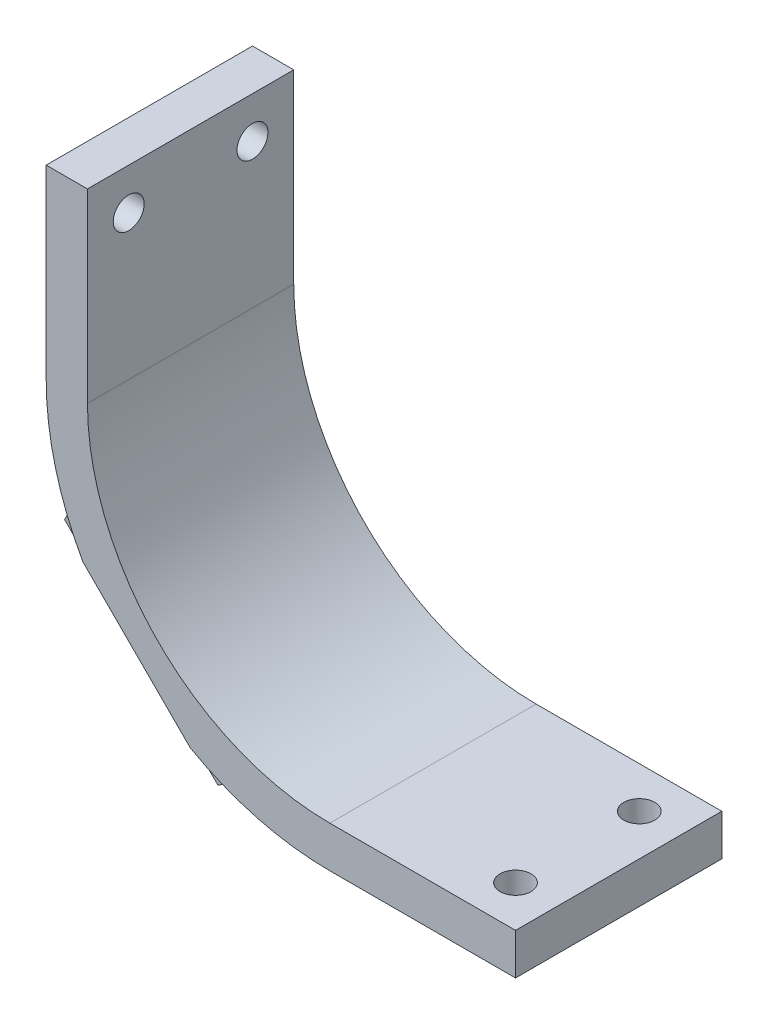
from build123d import *

# Parameters (mm, degrees)
EXTRUDE_1_DEPTH     = 40
SKETCH_4_R          = 11.5
SKETCH_4_R_2        = 1.8
EXTRUDE_3_DEPTH     = 8
CHAMFER_1_SIZE      = 5
CUT_EXTRUDE_4_DEPTH = 32
SKETCH_6_R          = 3
CUT_EXTRUDE_5_DEPTH = 32
SKETCH_7_R          = 3
CUT_EXTRUDE_6_DEPTH = 32


with BuildPart() as part:
    # 草图1 → 凸台-拉伸1 (new body)
    with BuildSketch(Plane.XY):
        with BuildLine():
            Line((0, 47), (0, 83))
            Line((0, 83), (-8, 83))
            Line((-8, 83), (-8, 47))
            ThreePointArc((-8, 47), (8.109127035, 8.109127035), (47, -8))
            Line((47, -8), (83, -8))
            Line((83, -8), (83, 0))
            Line((83, 0), (47, 0))
            ThreePointArc((47, 0), (13.765981284, 13.765981284), (0, 47))
        make_face()
    extrude(amount=EXTRUDE_1_DEPTH)

    # 草图4 → 凸台-拉伸3 (add)
    with BuildSketch(Plane(origin=(0, 0, 0), x_dir=(-1, 0, 0), z_dir=(0, 0, -1))):
        with BuildLine():
            Line((6.74011537, -36.43860018), (36.43860018, -6.74011537))
            Line((36.43860018, -6.74011537), (8, 47))
            ThreePointArc((8, 47), (-8.109127035, 8.109127035), (-47, -8))
            Line((-47, -8), (6.74011537, -36.43860018))
        make_face()
        with Locations((6.74011537, -6.74011537)):
            Circle(SKETCH_4_R, mode=Mode.SUBTRACT)
        with Locations((-15.180194847, -6.74011537)):
            Circle(SKETCH_4_R_2, mode=Mode.SUBTRACT)
        with Locations((6.74011537, 15.180194847)):
            Circle(SKETCH_4_R_2, mode=Mode.SUBTRACT)
        with Locations((6.74011537, -28.660425587)):
            Circle(SKETCH_4_R_2, mode=Mode.SUBTRACT)
        with Locations((28.660425587, -6.74011537)):
            Circle(SKETCH_4_R_2, mode=Mode.SUBTRACT)
    extrude(amount=-EXTRUDE_3_DEPTH)

    # 倒角1
    # the kernel refuses this chamfer: 5 mm, written as the material it adds along each edge
    with BuildSketch(Plane(origin=(47, 47, 8), x_dir=(-0.9727737558517583, 0.23175681203810172, 0), z_dir=(0.23175681203810172, 0.9727737558517583, 0))) as chamfer_1_piece_1_section:
        Polygon((55, CHAMFER_1_SIZE), (55 + CHAMFER_1_SIZE, 0), (55, 0), align=None)
    chamfer_1_piece_1 = revolve(axis=Axis((47, 47, 8), (0, 0, 1)), revolution_arc=116.801049414, mode=Mode.PRIVATE)
    chamfer_1_piece_1 = split(chamfer_1_piece_1, bisect_by=Plane(origin=(21.227823302, -21.638315136, 10.426045108), z_dir=(-0.46773292368325514, 0.8838698502057383, 0)), keep=Keep.TOP, mode=Mode.PRIVATE)
    chamfer_1_piece_1 = split(chamfer_1_piece_1, bisect_by=Plane(origin=(-21.638315136, 21.227823302, 10.426045108), z_dir=(0.8838698502057382, -0.46773292368325536, 0)), keep=Keep.TOP, mode=Mode.PRIVATE)
    add(chamfer_1_piece_1)

    # 草图5 → 切除-拉伸4 (cut)
    with BuildSketch(Plane.XY.offset(40)):
        Polygon((-7.447222151, 23.665476221), (-6.033008589, 25.079689783), (25.079689783, -6.033008589), (23.665476221, -7.447222151), (19.271084521, -11.841613851), (-11.841613851, 19.271084521), align=None)
    extrude(amount=-CUT_EXTRUDE_4_DEPTH, mode=Mode.SUBTRACT)

    # 草图6 → 切除-拉伸5 (cut)
    with BuildSketch(Plane.XZ.offset(8)):
        with Locations(Location((75, 8, 0), (0, 0, 270))):
            Circle(SKETCH_6_R)
        with Locations(Location((75, 32, 0), (0, 0, 270))):
            Circle(SKETCH_6_R)
    extrude(amount=-CUT_EXTRUDE_5_DEPTH, mode=Mode.SUBTRACT)

    # 草图7 → 切除-拉伸6 (cut)
    with BuildSketch(Plane.ZY.offset(8)):
        with Locations((8, 75)):
            Circle(SKETCH_7_R)
        with Locations((32, 75)):
            Circle(SKETCH_7_R)
    extrude(amount=-CUT_EXTRUDE_6_DEPTH, mode=Mode.SUBTRACT)


solid = part.part
